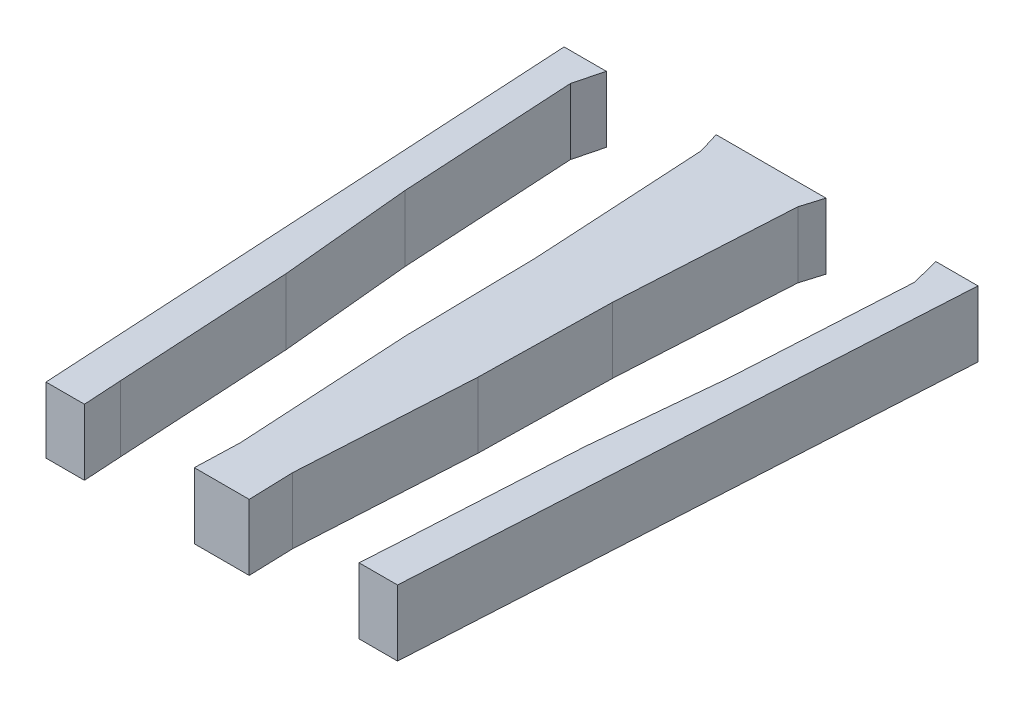
from build123d import *

# Parameters (mm, degrees)
BOSS_EXTRUDE1_DEPTH = 3
CUT_EXTRUDE1_DEPTH  = 91.044316414
BOSS_EXTRUDE2_DEPTH = 3
CUT_EXTRUDE7_DEPTH  = 91.044316414
CUT_EXTRUDE9_DEPTH  = 91.044316414
MIRROR10_DEPTH      = 3


# Read off the part's stored shape, not the designer's step: Mirror10
with BuildPart() as part:
    # Sketch1 → Boss-Extrude1 (new body)
    with BuildSketch(Plane(origin=(0, 0, 0), x_dir=(1, 0, 0), z_dir=(0, 1, 0))):
        Polygon((-9.419602878, 89.5), (-8, 64.5), (0, 64.5), (0, 89.5), align=None)
    extrude(amount=BOSS_EXTRUDE1_DEPTH)

    # Sketch2 → Cut-Extrude1 (cut, symmetric)
    with BuildSketch(Plane(origin=(0, 3, 0), x_dir=(1, 0, 0), z_dir=(0, 1, 0))):
        Polygon((-6.585534884, 66.233172431), (-0.954605862, 66.552919753), (-2.201847188, 88.517536505), (-7.83277621, 88.197789183), align=None)
    extrude(amount=CUT_EXTRUDE1_DEPTH, both=True, mode=Mode.SUBTRACT)

    # Sketch6 → Boss-Extrude2 (add)
    with BuildSketch(Plane(origin=(0, 3, 0), x_dir=(1, 0, 0), z_dir=(0, 1, 0))):
        Polygon((-6.585534884, 66.233172431), (-6.3559048, 66.246211772), (-6.8094471, 74.233345137), (-7.37923391, 80.210655819), align=None)
    boss_extrude2 = extrude(amount=-BOSS_EXTRUDE2_DEPTH)

    # Mirror3: Boss-Extrude2 across plane
    add(boss_extrude2.mirror(Plane(origin=(0, 0, 0), x_dir=(0.05669278756337804, 0, 0.9983916705573488), z_dir=(0.9983916705573489, 0, -0.05669278756337803))))

    # Sketch7 → Cut-Extrude7 (cut, symmetric)
    with BuildSketch(Plane(origin=(0, 3, 0), x_dir=(1, 0, 0), z_dir=(0, 1, 0))):
        Polygon((-7.5, 89.5), (-7.83277621, 88.197789183), (-2.201847188, 88.517536505), (-2.5, 89.5), align=None)
    extrude(amount=CUT_EXTRUDE7_DEPTH, both=True, mode=Mode.SUBTRACT)

    # Sketch14 → Cut-Extrude9 (cut, symmetric)
    with BuildSketch(Plane(origin=(0, 3, 0), x_dir=(1, 0, 0), z_dir=(0, 1, 0))):
        Polygon((-6.3559048, 66.246211772), (-6.25, 64.5), (-1.25, 64.5), (-1.184235946, 66.539880412), align=None)
    extrude(amount=CUT_EXTRUDE9_DEPTH, both=True, mode=Mode.SUBTRACT)


with BuildPart() as cut_extrude9_piece_1:
    # of the separate pieces the step leaves, piece 1, a body of its own (cut_extrude9_pieces)
    add(part.part.solids().sort_by_distance((-1.25, 0, -64.5))[0])

    # Mirror10 outline → Mirror10 (add)
    with BuildSketch(Plane(origin=(0, 0, 0), x_dir=(1, 0, 0), z_dir=(0, 1, 0))):
        Polygon((0, 64.5), (1.25, 64.5), (1.184235946, 66.539880412), (1.637778247, 74.527013776), (1.748304888, 80.530403141), (2.201847188, 88.517536505), (2.5, 89.5), (0, 89.5), align=None)
    extrude(amount=MIRROR10_DEPTH)


with BuildPart() as cut_extrude9_piece_2:
    # of the separate pieces the step leaves, piece 2, a body of its own (cut_extrude9_pieces)
    add(part.part.solids().sort_by_distance((-9.419602878, 0, -89.5))[0])


with BuildPart() as body_3:
    # Mirror12: mirrored copy
    add(cut_extrude9_piece_2.part.mirror(Plane(origin=(0, 0, 0), x_dir=(0, 0, 1), z_dir=(1, 0, 0))))


solid = Compound([cut_extrude9_piece_1.part, cut_extrude9_piece_2.part, body_3.part])
